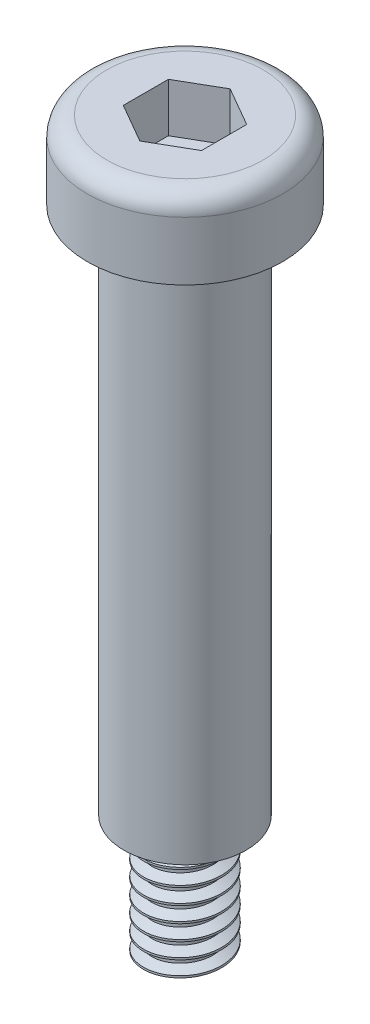
from build123d import *

# Parameters (mm, degrees)
THREAD1_PITCH      = 0.8
THREAD1_TO         = 8
FILLET1_R          = 1
CUT_EXTRUDE1_DEPTH = 2.5


with BuildPart() as part:
    # Sketch1 → Revolve1 (revolve)
    with BuildSketch(Plane.XY, mode=Mode.PRIVATE) as revolve1_sk:
        Polygon((-2, 0), (-2, 6), (-3.125, 6), (-3.125, 33), (-5, 33), (-5, 37), (0, 37), (0, 0), align=None)
    revolve(revolve1_sk.sketch.rotate(Axis((0, 0, 0), (0, 1, 0)), 270), axis=Axis((0, 0, 0), (0, 1, 0)))

    # Thread1: arcs per turn and ends read off the stored shape
    # Thread1: the profile of Thread Profile1 profile screwed along a right-hand helix through 10 turns, 8 arcs to a turn; built about Z, then put on its axis
    thread1_z = Axis((0, 0, 0), (0, 0, 1))
    thread1_corners = [(2.0003, 0, -0.000173205), (2.0003, 0, 0.700173203), (1.5669873, 0, 0.449999999), (1.5669873, 0, 0.249999999)]
    with BuildLine(mode=Mode.PRIVATE) as thread1_profile:
        Line(thread1_corners[0], thread1_corners[1])
        Line(thread1_corners[1], thread1_corners[2])
        Line(thread1_corners[2], thread1_corners[3])
        Line(thread1_corners[3], thread1_corners[0])
    thread1_cap = Face(thread1_profile.wire())
    thread1_turn_angles = [0, 22.5, 45, 67.5, 90, 112.5, 135, 157.5, 180, 202.5, 225, 247.5, 270, 292.5, 315, 337.5, 360]
    thread1_turn_weights = [1, 0.9238795325112867, 1, 0.9238795325112867, 1, 0.9238795325112867, 1, 0.9238795325112867, 1, 0.9238795325112867, 1, 0.9238795325112867, 1, 0.9238795325112867, 1, 0.9238795325112867, 1]
    thread1_turn_rails = [Edge.make_bspline([Vector(p[0], p[1], 0).rotate(thread1_z, thread1_turn_angles[k]) / thread1_turn_weights[k] + Vector(0, 0, p[2] + THREAD1_PITCH * thread1_turn_angles[k] / 360) for k in range(17)], [0, 0, 0, 1, 1, 2, 2, 3, 3, 4, 4, 5, 5, 6, 6, 7, 7, 8, 8, 8], 2, thread1_turn_weights) for p in thread1_corners]
    thread1_turn_sides = [Face.make_surface_from_curves(thread1_turn_rails[p[0]], thread1_turn_rails[p[1]]) for p in [(0, 1), (1, 2), (2, 3), (3, 0)]]
    thread1 = Plane(origin=(0, -2, 0), x_dir=(1, 0, 0), z_dir=(0, 1, 0)) * split(Solid(Shell([*[p.moved(Location((0, 0, THREAD1_PITCH * i))) for i in range(10) for p in thread1_turn_sides], thread1_cap, thread1_cap.rotate(thread1_z, 3600).moved(Location((0, 0, THREAD1_PITCH * 3600 / 360)))])), bisect_by=Plane.XY.offset(THREAD1_TO), keep=Keep.BOTTOM, mode=Mode.PRIVATE)
    add(thread1, mode=Mode.SUBTRACT)

    # Fillet1
    fillet1_edges = [part.edges().sort_by_distance(p)[0] for p in [
        (0, 37, 5),
    ]]
    fillet(fillet1_edges, radius=FILLET1_R)

    # Sketch5 → Cut-Extrude1 (cut)
    with BuildSketch(Plane(origin=(0, 37, 0), x_dir=(1, 0, 0), z_dir=(0, 1, 0))):
        Polygon((0, 2.309401077), (-2, 1.154700538), (-2, -1.154700538), (0, -2.309401077), (2, -1.154700538), (2, 1.154700538), align=None)
    extrude(amount=-CUT_EXTRUDE1_DEPTH, mode=Mode.SUBTRACT)


solid = part.part
